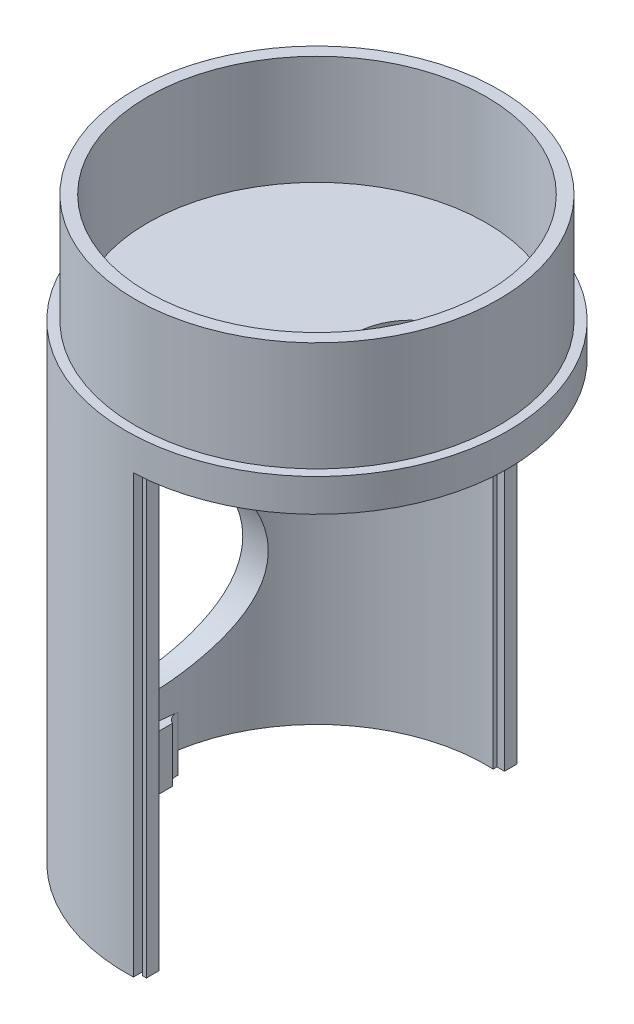
from build123d import *

# Parameters (mm, degrees)
BOSS_EXTRUDE1_DEPTH     = 40
SKETCH16_R              = 17.5
BOSS_EXTRUDE2_DEPTH     = 3
SKETCH17_R              = 16.65
SKETCH17_R_2            = 15.5
BOSS_EXTRUDE3_DEPTH     = 10
SKETCH18_R              = 8.5
CUT_EXTRUDE1_DEPTH      = 30
BOSS_EXTRUDE4_DEPTH     = 3
FILLET1_R               = 1
FILLET3_R               = 1
BOSS_EXTRUDE5_START     = 2
BOSS_EXTRUDE5_DEPTH     = 2
CUT_EXTRUDE3_DEPTH      = 61.311690469
CUT_EXTRUDE3_DEPTH_BACK = 2
SKETCH28_R              = 5.051145337
CUT_EXTRUDE4_DEPTH      = 10


with BuildPart() as part:
    # Sketch13 → Boss-Extrude1 (new body)
    with BuildSketch(Plane(origin=(0, 0, 0), x_dir=(1, 0, 0), z_dir=(0, 1, 0))):
        with BuildLine():
            Line((0.65523527, 15.486144347), (0.65523527, 15.830625123))
            Line((0.65523527, 15.830625123), (1.340586782, 15.830625123))
            Line((1.340586782, 15.830625123), (1.342992881, 16.95829018))
            Line((1.342992881, 16.95829018), (0.999793375, 16.95829018))
            Line((0.999793375, 16.95829018), (0.999793375, 16.661380915))
            Line((0.999793375, 16.661380915), (0.670404475, 16.661380915))
            Line((0.670404475, 16.661380915), (0.670404475, 17.487154081))
            ThreePointArc((0.670404475, 17.487154081), (-17.5, 0), (0.670404475, -17.487154081))
            Line((0.670404475, -17.487154081), (0.670404475, -16.661380915))
            Line((0.670404475, -16.661380915), (0.999793375, -16.661380915))
            Line((0.999793375, -16.661380915), (0.999793375, -16.95829018))
            Line((0.999793375, -16.95829018), (1.342992881, -16.95829018))
            Line((1.342992881, -16.95829018), (1.340586782, -15.830625123))
            Line((1.340586782, -15.830625123), (0.65523527, -15.830625123))
            Line((0.65523527, -15.830625123), (0.65523527, -15.486144347))
            ThreePointArc((0.65523527, -15.486144347), (-15.5, 0), (0.65523527, 15.486144347))
        make_face()
    extrude(amount=BOSS_EXTRUDE1_DEPTH)

    # Sketch16 → Boss-Extrude2 (add)
    with BuildSketch(Plane(origin=(0, 40, 0), x_dir=(1, 0, 0), z_dir=(0, 1, 0))):
        Circle(SKETCH16_R)
    extrude(amount=BOSS_EXTRUDE2_DEPTH)

    # Sketch17 → Boss-Extrude3 (add)
    with BuildSketch(Plane(origin=(0, 43, 0), x_dir=(1, 0, 0), z_dir=(0, 1, 0))):
        Circle(SKETCH17_R)
        Circle(SKETCH17_R_2, mode=Mode.SUBTRACT)
    extrude(amount=BOSS_EXTRUDE3_DEPTH)

    # Sketch18 → Cut-Extrude1 (cut)
    with BuildSketch(Plane(origin=(0, 0, 0), x_dir=(0, 0, -1), z_dir=(1, 0, 0))):
        with Locations((0, 14)):
            Circle(SKETCH18_R)
    extrude(amount=-CUT_EXTRUDE1_DEPTH, mode=Mode.SUBTRACT)

    # Sketch20 → Boss-Extrude4 (add)
    with BuildSketch(Plane.XZ):
        with BuildLine():
            Line((-14.667785333, 1.448781774), (-14.667785333, -1.448781774))
            ThreePointArc((-14.667785333, -1.448781774), (-15.025977642, -1.602140032), (-15.409950004, -1.668364732))
            ThreePointArc((-15.409950004, -1.668364732), (-15.5, 0), (-15.409950004, 1.668364732))
            ThreePointArc((-15.409950004, 1.668364732), (-15.025977642, 1.602140032), (-14.667785333, 1.448781774))
        make_face()
    extrude(amount=-BOSS_EXTRUDE4_DEPTH)

    # Fillet1
    fillet1_edges = [part.edges().sort_by_distance(p)[0] for p in [
        (-15.409950004, 1.5, 1.668364732),
    ]]
    fillet(fillet1_edges, radius=FILLET1_R)

    # Fillet3
    fillet3_edges = [part.edges().sort_by_distance(p)[0] for p in [
        (-15.409950004, 1.5, -1.668364732),
    ]]
    fillet(fillet3_edges, radius=FILLET3_R)

    # Sketch25 → Boss-Extrude5 (add)
    with BuildSketch(Plane.XZ.offset(BOSS_EXTRUDE5_START)):
        with BuildLine():
            Line((-15.5, 2.560490416), (-15.5, -2.560490416))
            ThreePointArc((-15.5, -2.560490416), (-15.394165826, -2.55830223), (-15.288512543, -2.551741411))
            ThreePointArc((-15.288512543, -2.551741411), (-15.193650033, -1.934078734), (-14.750654034, -1.493328665))
            ThreePointArc((-14.750654034, -1.493328665), (-14.708906064, -1.471638632), (-14.667785333, -1.448781774))
            Line((-14.667785333, -1.448781774), (-14.667785333, 1.448781774))
            ThreePointArc((-14.667785333, 1.448781774), (-14.708906064, 1.471638632), (-14.750654034, 1.493328665))
            ThreePointArc((-14.750654034, 1.493328665), (-15.193650033, 1.934078734), (-15.288512543, 2.551741411))
            ThreePointArc((-15.288512543, 2.551741411), (-15.394165826, 2.55830223), (-15.5, 2.560490416))
        make_face()
    extrude(amount=-BOSS_EXTRUDE5_DEPTH)

    # Sketch27 → Cut-Extrude3 (cut, two sides: drawn at the far end of the back side and taken through both)
    with BuildSketch(Plane.XZ.offset(2).offset(-CUT_EXTRUDE3_DEPTH_BACK)):
        Polygon((-2.449812891, 88.465397975), (-15.288512543, 2.551741411), (-15.5, 1.136515472), (-15.5, -1.238247673), (-15.288512543, -2.551741411), (-1.479680579, -88.314814775), (-175.212364278, -89.268222894), (-176.18249659, 87.511989856), align=None)
    extrude(amount=CUT_EXTRUDE3_DEPTH + CUT_EXTRUDE3_DEPTH_BACK, mode=Mode.SUBTRACT)

    # Sketch28 → Cut-Extrude4 (cut)
    with BuildSketch(Plane(origin=(0, 43, 0), x_dir=(1, 0, 0), z_dir=(0, 1, 0))):
        with Locations((7.825464684, 0.736813233)):
            Circle(SKETCH28_R)
    extrude(amount=-CUT_EXTRUDE4_DEPTH, mode=Mode.SUBTRACT)


solid = part.part
